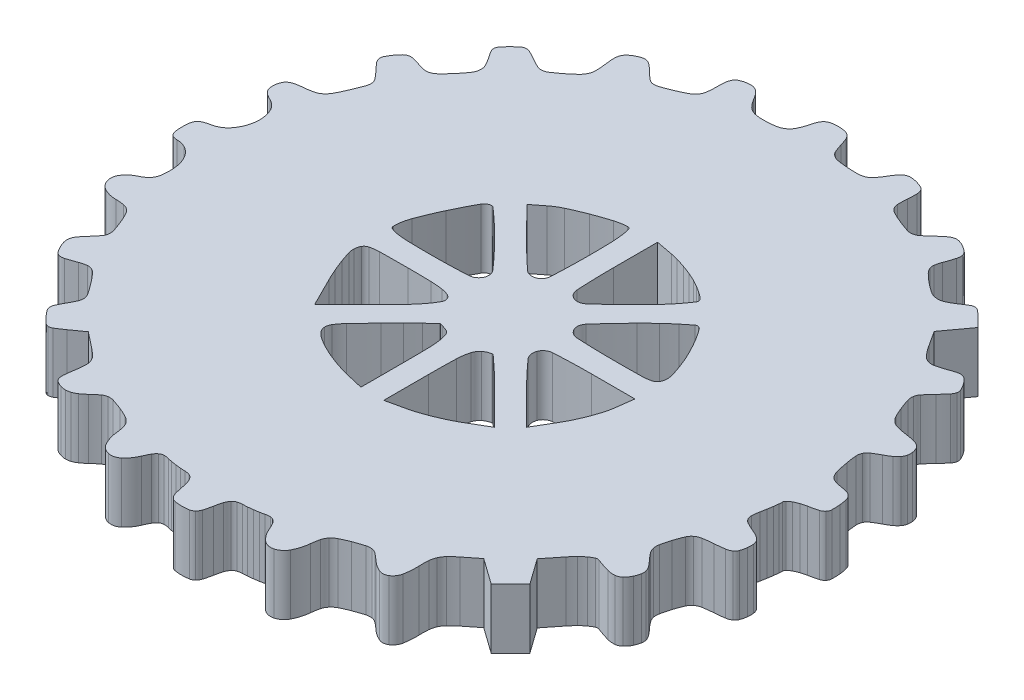
from build123d import *

# Parameters (mm, degrees)
BOSS_EXTRUDE1_DEPTH = 1
SCALE1_SCALE        = 42


with BuildPart() as part:
    # Sketch1 → Boss-Extrude1 (new body)
    with BuildSketch(Plane(origin=(0, 0, 0), x_dir=(1, 0, 0), z_dir=(0, 1, 0))):
        with BuildLine():
            Line((10740.074433407, 3244.208549492), (10740.283419679, 3244.357360853))
            Line((10740.283419679, 3244.357360853), (10740.526958156, 3244.166763317))
            ThreePointArc((10740.526958156, 3244.166763317), (10740.596441055, 3244.109518452), (10740.662967002, 3244.048862486))
            ThreePointArc((10740.662967002, 3244.048862486), (10740.697910655, 3244.007526997), (10740.723503483, 3243.959833301))
            ThreePointArc((10740.723503483, 3243.959833301), (10740.738165734, 3243.908707265), (10740.74146969, 3243.855623019))
            ThreePointArc((10740.74146969, 3243.855623019), (10740.735078414, 3243.769929716), (10740.723894084, 3243.684729356))
            ThreePointArc((10740.723894084, 3243.684729356), (10740.712253348, 3243.602537411), (10740.703557142, 3243.519981984))
            ThreePointArc((10740.703557142, 3243.519981984), (10740.704378804, 3243.476674484), (10740.714298828, 3243.434510425))
            ThreePointArc((10740.714298828, 3243.434510425), (10740.731066326, 3243.404155572), (10740.756883883, 3243.381003471))
            ThreePointArc((10740.756883883, 3243.381003471), (10740.79946354, 3243.357773389), (10740.844661407, 3243.340171777))
            ThreePointArc((10740.844661407, 3243.340171777), (10740.887751217, 3243.329889789), (10740.931879165, 3243.325994234))
            ThreePointArc((10740.931879165, 3243.325994234), (10740.973993155, 3243.328922243), (10741.015017251, 3243.338881406))
            ThreePointArc((10741.015017251, 3243.338881406), (10741.058887667, 3243.357110334), (10741.099722923, 3243.381387671))
            ThreePointArc((10741.099722923, 3243.381387671), (10741.147341166, 3243.41716042), (10741.192213188, 3243.456322751))
            ThreePointArc((10741.192213188, 3243.456322751), (10741.248594743, 3243.506337601), (10741.307739475, 3243.553052327))
            ThreePointArc((10741.307739475, 3243.553052327), (10741.345796905, 3243.574276951), (10741.388057704, 3243.584901336))
            ThreePointArc((10741.388057704, 3243.584901336), (10741.435491272, 3243.585271253), (10741.481915987, 3243.575533384))
            ThreePointArc((10741.481915987, 3243.575533384), (10741.572466774, 3243.544516154), (10741.661980473, 3243.510622033))
            ThreePointArc((10741.661980473, 3243.510622033), (10741.740568657, 3243.476890803), (10741.817184023, 3243.438891011))
            ThreePointArc((10741.817184023, 3243.438891011), (10741.863418008, 3243.408420708), (10741.903082074, 3243.369784164))
            ThreePointArc((10741.903082074, 3243.369784164), (10741.931919686, 3243.327176018), (10741.950884239, 3243.279349166))
            ThreePointArc((10741.950884239, 3243.279349166), (10741.966827587, 3243.210056526), (10741.976814794, 3243.139658259))
            ThreePointArc((10741.976814794, 3243.139658259), (10742.002448782, 3243.010444585), (10742.052640957, 3242.888649591))
            ThreePointArc((10742.052640957, 3242.888649591), (10742.11741492, 3242.811397421), (10742.208001403, 3242.767152044))
            ThreePointArc((10742.208001403, 3242.767152044), (10742.301649043, 3242.766532205), (10742.385137294, 3242.808958336))
            ThreePointArc((10742.385137294, 3242.808958336), (10742.466720923, 3242.897440298), (10742.52548375, 3243.002473037))
            ThreePointArc((10742.52548375, 3243.002473037), (10742.551916827, 3243.061388768), (10742.581725217, 3243.118670798))
            ThreePointArc((10742.581725217, 3243.118670798), (10742.60534874, 3243.15217229), (10742.635454523, 3243.179994272))
            ThreePointArc((10742.635454523, 3243.179994272), (10742.665408797, 3243.196107102), (10742.698749215, 3243.202837508))
            ThreePointArc((10742.698749215, 3243.202837508), (10742.740911169, 3243.201717964), (10742.782378334, 3243.194013548))
            ThreePointArc((10742.782378334, 3243.194013548), (10742.818709321, 3243.185028526), (10742.855368028, 3243.177491254))
            ThreePointArc((10742.855368028, 3243.177491254), (10742.899150416, 3243.169929059), (10742.943100517, 3243.163411932))
            ThreePointArc((10742.943100517, 3243.163411932), (10742.987075383, 3243.15795862), (10743.031167752, 3243.153555158))
            ThreePointArc((10743.031167752, 3243.153555158), (10743.068116243, 3243.151064448), (10743.105135397, 3243.150076094))
            ThreePointArc((10743.105135397, 3243.150076094), (10743.146525145, 3243.146143619), (10743.186579329, 3243.13499741))
            ThreePointArc((10743.186579329, 3243.13499741), (10743.218277129, 3243.117906199), (10743.244280026, 3243.09299216))
            ThreePointArc((10743.244280026, 3243.09299216), (10743.268631813, 3243.05568758), (10743.285607477, 3243.014499378))
            ThreePointArc((10743.285607477, 3243.014499378), (10743.303720248, 3242.948872196), (10743.318138248, 3242.882335583))
            ThreePointArc((10743.318138248, 3242.882335583), (10743.333961344, 3242.808713676), (10743.353627026, 3242.736023811))
            ThreePointArc((10743.353627026, 3242.736023811), (10743.37098035, 3242.696552266), (10743.397473344, 3242.662533711))
            ThreePointArc((10743.397473344, 3242.662533711), (10743.429020625, 3242.639307278), (10743.466042295, 3242.62649736))
            ThreePointArc((10743.466042295, 3242.62649736), (10743.525192509, 3242.618356676), (10743.584838248, 3242.615635583))
            ThreePointArc((10743.584838248, 3242.615635583), (10743.644483986, 3242.618356676), (10743.7036342, 3242.62649736))
            ThreePointArc((10743.7036342, 3242.62649736), (10743.740655871, 3242.639307278), (10743.772203151, 3242.662533711))
            ThreePointArc((10743.772203151, 3242.662533711), (10743.798696145, 3242.696552266), (10743.816049469, 3242.736023811))
            ThreePointArc((10743.816049469, 3242.736023811), (10743.835715152, 3242.808713676), (10743.851538248, 3242.882335583))
            ThreePointArc((10743.851538248, 3242.882335583), (10743.866116249, 3242.949694769), (10743.884400336, 3243.016143774))
            ThreePointArc((10743.884400336, 3243.016143774), (10743.901396912, 3243.057141353), (10743.925963931, 3243.094102775))
            ThreePointArc((10743.925963931, 3243.094102775), (10743.952513167, 3243.118822075), (10743.984782406, 3243.135393192))
            ThreePointArc((10743.984782406, 3243.135393192), (10744.026567429, 3243.146246022), (10744.069568622, 3243.150076094))
            ThreePointArc((10744.069568622, 3243.150076094), (10744.10755751, 3243.151065395), (10744.145477233, 3243.153561177))
            ThreePointArc((10744.145477233, 3243.153561177), (10744.190374429, 3243.157952035), (10744.235154194, 3243.163411932))
            ThreePointArc((10744.235154194, 3243.163411932), (10744.279669278, 3243.169920387), (10744.324016424, 3243.177488968))
            ThreePointArc((10744.324016424, 3243.177488968), (10744.360852789, 3243.185005789), (10744.397353209, 3243.194013548))
            ThreePointArc((10744.397353209, 3243.194013548), (10744.438820374, 3243.201717964), (10744.480982328, 3243.202837508))
            ThreePointArc((10744.480982328, 3243.202837508), (10744.514322746, 3243.196107102), (10744.54427702, 3243.179994272))
            ThreePointArc((10744.54427702, 3243.179994272), (10744.574382802, 3243.15217229), (10744.598006326, 3243.118670798))
            ThreePointArc((10744.598006326, 3243.118670798), (10744.627814716, 3243.061388768), (10744.654247793, 3243.002473037))
            ThreePointArc((10744.654247793, 3243.002473037), (10744.713333089, 3242.896798932), (10744.79533316, 3242.807725496))
            ThreePointArc((10744.79533316, 3242.807725496), (10744.878895795, 3242.765509222), (10744.972505322, 3242.766987147))
            ThreePointArc((10744.972505322, 3242.766987147), (10745.063287397, 3242.812720388), (10745.127676564, 3242.891377551))
            ThreePointArc((10745.127676564, 3242.891377551), (10745.17751834, 3243.015596826), (10745.202916749, 3243.147010492))
            ThreePointArc((10745.202916749, 3243.147010492), (10745.212831011, 3243.2201075), (10745.228442911, 3243.29220281))
            ThreePointArc((10745.228442911, 3243.29220281), (10745.246704719, 3243.340113978), (10745.275125926, 3243.382789599))
            ThreePointArc((10745.275125926, 3243.382789599), (10745.31408887, 3243.420708524), (10745.359794566, 3243.450152456))
            ThreePointArc((10745.359794566, 3243.450152456), (10745.437013645, 3243.486974008), (10745.516145002, 3243.519483102))
            ThreePointArc((10745.516145002, 3243.519483102), (10745.604834591, 3243.551313454), (10745.694592372, 3243.579993675))
            ThreePointArc((10745.694592372, 3243.579993675), (10745.742038199, 3243.588725509), (10745.790247375, 3243.58692917))
            ThreePointArc((10745.790247375, 3243.58692917), (10745.834102364, 3243.574673903), (10745.873533213, 3243.551899802))
            ThreePointArc((10745.873533213, 3243.551899802), (10745.936030865, 3243.501814129), (10745.995819659, 3243.448524062))
            ThreePointArc((10745.995819659, 3243.448524062), (10746.081017568, 3243.381468959), (10746.176578175, 3243.330251375))
            ThreePointArc((10746.176578175, 3243.330251375), (10746.250689502, 3243.318289874), (10746.321729497, 3243.342556837))
            ThreePointArc((10746.321729497, 3243.342556837), (10746.381649137, 3243.401058157), (10746.414109805, 3243.478253187))
            ThreePointArc((10746.414109805, 3243.478253187), (10746.431421076, 3243.604109068), (10746.433108066, 3243.731138737))
            ThreePointArc((10746.433108066, 3243.731138737), (10746.431802994, 3243.811493208), (10746.435669452, 3243.891765213))
            ThreePointArc((10746.435669452, 3243.891765213), (10746.44511738, 3243.94861337), (10746.463978895, 3244.0030672))
            ThreePointArc((10746.463978895, 3244.0030672), (10746.491476128, 3244.052924743), (10746.527117682, 3244.097326905))
            ThreePointArc((10746.527117682, 3244.097326905), (10746.58287424, 3244.151784438), (10746.642264035, 3244.202254914))
            Line((10746.642264035, 3244.202254914), (10746.865677711, 3244.379174246))
            Line((10746.865677711, 3244.379174246), (10747.081750431, 3244.225316921))
            Line((10747.081750431, 3244.225316921), (10747.297823151, 3244.071459596))
            Line((10747.297823151, 3244.071459596), (10747.459132455, 3244.2327689))
            Line((10747.459132455, 3244.2327689), (10747.620441759, 3244.394078204))
            Line((10747.620441759, 3244.394078204), (10747.467779936, 3244.608471933))
            Line((10747.467779936, 3244.608471933), (10747.315118113, 3244.822865738))
            Line((10747.315118113, 3244.822865738), (10747.528941942, 3245.091430581))
            ThreePointArc((10747.528941942, 3245.091430581), (10747.572647945, 3245.143303748), (10747.619164418, 3245.192672339))
            ThreePointArc((10747.619164418, 3245.192672339), (10747.663231099, 3245.233522951), (10747.71040927, 3245.270736725))
            ThreePointArc((10747.71040927, 3245.270736725), (10747.749729632, 3245.296626084), (10747.791251527, 3245.318813514))
            ThreePointArc((10747.791251527, 3245.318813514), (10747.817949927, 3245.325423554), (10747.845094827, 3245.320990548))
            ThreePointArc((10747.845094827, 3245.320990548), (10747.956592049, 3245.281096056), (10748.069634815, 3245.245818105))
            ThreePointArc((10748.069634815, 3245.245818105), (10748.136772514, 3245.233139997), (10748.205096241, 3245.233410917))
            ThreePointArc((10748.205096241, 3245.233410917), (10748.254433512, 3245.246626323), (10748.296971114, 3245.274899378))
            ThreePointArc((10748.296971114, 3245.274899378), (10748.337353886, 3245.320521803), (10748.368164241, 3245.373085059))
            ThreePointArc((10748.368164241, 3245.373085059), (10748.387797837, 3245.422241635), (10748.402120866, 3245.473199439))
            ThreePointArc((10748.402120866, 3245.473199439), (10748.406123854, 3245.512902509), (10748.400532706, 3245.552413225))
            ThreePointArc((10748.400532706, 3245.552413225), (10748.384777717, 3245.594593068), (10748.361235299, 3245.632974227))
            ThreePointArc((10748.361235299, 3245.632974227), (10748.316845967, 3245.688679151), (10748.269593674, 3245.741977108))
            ThreePointArc((10748.269593674, 3245.741977108), (10748.218715914, 3245.799745927), (10748.171338574, 3245.860418578))
            ThreePointArc((10748.171338574, 3245.860418578), (10748.147054637, 3245.902416081), (10748.132444037, 3245.948676542))
            ThreePointArc((10748.132444037, 3245.948676542), (10748.127602294, 3245.998880229), (10748.132891712, 3246.049038724))
            ThreePointArc((10748.132891712, 3246.049038724), (10748.152253002, 3246.132215804), (10748.175423199, 3246.214413298))
            ThreePointArc((10748.175423199, 3246.214413298), (10748.202989565, 3246.295914221), (10748.235133672, 3246.375720621))
            ThreePointArc((10748.235133672, 3246.375720621), (10748.260891475, 3246.418823525), (10748.296680107, 3246.454044239))
            ThreePointArc((10748.296680107, 3246.454044239), (10748.341152037, 3246.480089921), (10748.390546696, 3246.494796989))
            ThreePointArc((10748.390546696, 3246.494796989), (10748.481770871, 3246.508132379), (10748.573530175, 3246.517071773))
            ThreePointArc((10748.573530175, 3246.517071773), (10748.661269881, 3246.525200856), (10748.748630765, 3246.53670798))
            ThreePointArc((10748.748630765, 3246.53670798), (10748.79408457, 3246.548733822), (10748.835887918, 3246.570254725))
            ThreePointArc((10748.835887918, 3246.570254725), (10748.864524442, 3246.596606073), (10748.883414773, 3246.630629585))
            ThreePointArc((10748.883414773, 3246.630629585), (10748.899243437, 3246.683869725), (10748.908824882, 3246.738580373))
            ThreePointArc((10748.908824882, 3246.738580373), (10748.911904869, 3246.791265861), (10748.908953736, 3246.843958724))
            ThreePointArc((10748.908953736, 3246.843958724), (10748.89939208, 3246.882692414), (10748.880271218, 3246.917708361))
            ThreePointArc((10748.880271218, 3246.917708361), (10748.850494987, 3246.950668734), (10748.814451334, 3246.976627649))
            ThreePointArc((10748.814451334, 3246.976627649), (10748.754258299, 3247.008487913), (10748.692185996, 3247.036511247))
            ThreePointArc((10748.692185996, 3247.036511247), (10748.625184118, 3247.066438897), (10748.559920703, 3247.099988895))
            ThreePointArc((10748.559920703, 3247.099988895), (10748.526444894, 3247.124634018), (10748.500585592, 3247.157181034))
            ThreePointArc((10748.500585592, 3247.157181034), (10748.485490133, 3247.193731469), (10748.481660103, 3247.23309056))
            ThreePointArc((10748.481660103, 3247.23309056), (10748.487302385, 3247.297710591), (10748.497676962, 3247.361741458))
            ThreePointArc((10748.497676962, 3247.361741458), (10748.50668515, 3247.408642953), (10748.514975581, 3247.455676627))
            ThreePointArc((10748.514975581, 3247.455676627), (10748.522636851, 3247.503323132), (10748.529591579, 3247.551077884))
            ThreePointArc((10748.529591579, 3247.551077884), (10748.535090352, 3247.593180436), (10748.539970248, 3247.635359199))
            ThreePointArc((10748.539970248, 3247.635359199), (10748.542141379, 3247.662144424), (10748.542865771, 3247.689007733))
            ThreePointArc((10748.542865771, 3247.689007733), (10748.547752305, 3247.7122233), (10748.561582701, 3247.731499215))
            ThreePointArc((10748.561582701, 3247.731499215), (10748.590724503, 3247.755242581), (10748.622389996, 3247.775498162))
            ThreePointArc((10748.622389996, 3247.775498162), (10748.665252675, 3247.796961527), (10748.709959494, 3247.814258511))
            ThreePointArc((10748.709959494, 3247.814258511), (10748.76137366, 3247.829465445), (10748.813703279, 3247.84113928))
            ThreePointArc((10748.813703279, 3247.84113928), (10748.89298929, 3247.857852496), (10748.971450919, 3247.878085536))
            ThreePointArc((10748.971450919, 3247.878085536), (10749.00831331, 3247.894621253), (10749.038802727, 3247.921129011))
            ThreePointArc((10749.038802727, 3247.921129011), (10749.058334303, 3247.953788679), (10749.065917507, 3247.991079849))
            ThreePointArc((10749.065917507, 3247.991079849), (10749.065871249, 3248.060784268), (10749.061353279, 3248.130342131))
            ThreePointArc((10749.061353279, 3248.130342131), (10749.053217814, 3248.191386868), (10749.040768687, 3248.251699927))
            ThreePointArc((10749.040768687, 3248.251699927), (10749.026578389, 3248.290638163), (10749.004205184, 3248.325523554))
            ThreePointArc((10749.004205184, 3248.325523554), (10748.976817154, 3248.351545318), (10748.943648358, 3248.369630324))
            ThreePointArc((10748.943648358, 3248.369630324), (10748.89638316, 3248.384766267), (10748.847665771, 3248.394237894))
            ThreePointArc((10748.847665771, 3248.394237894), (10748.769714515, 3248.407976182), (10748.693165395, 3248.428110014))
            ThreePointArc((10748.693165395, 3248.428110014), (10748.647414728, 3248.449905661), (10748.609876737, 3248.483950821))
            ThreePointArc((10748.609876737, 3248.483950821), (10748.578312819, 3248.532298465), (10748.558033229, 3248.586358745))
            ThreePointArc((10748.558033229, 3248.586358745), (10748.532623967, 3248.694487102), (10748.511195299, 3248.803474185))
            ThreePointArc((10748.511195299, 3248.803474185), (10748.498345791, 3248.887244874), (10748.489464049, 3248.971528637))
            ThreePointArc((10748.489464049, 3248.971528637), (10748.491604131, 3249.017310383), (10748.505275549, 3249.06105556))
            ThreePointArc((10748.505275549, 3249.06105556), (10748.529209616, 3249.098553054), (10748.562402461, 3249.128169548))
            ThreePointArc((10748.562402461, 3249.128169548), (10748.628650714, 3249.169970629), (10748.697176182, 3249.207923516))
            ThreePointArc((10748.697176182, 3249.207923516), (10748.753403166, 3249.239397138), (10748.80742798, 3249.274516677))
            ThreePointArc((10748.80742798, 3249.274516677), (10748.843749411, 3249.304582342), (10748.874677071, 3249.340172655))
            ThreePointArc((10748.874677071, 3249.340172655), (10748.894617843, 3249.374484129), (10748.90681785, 3249.412247492))
            ThreePointArc((10748.90681785, 3249.412247492), (10748.91186594, 3249.454547925), (10748.909539028, 3249.497084914))
            ThreePointArc((10748.909539028, 3249.497084914), (10748.89952172, 3249.540111354), (10748.882175913, 3249.580740703))
            ThreePointArc((10748.882175913, 3249.580740703), (10748.859631192, 3249.612467782), (10748.829842058, 3249.637517323))
            ThreePointArc((10748.829842058, 3249.637517323), (10748.786648254, 3249.66033847), (10748.740179499, 3249.67541044))
            ThreePointArc((10748.740179499, 3249.67541044), (10748.665957765, 3249.690665894), (10748.591072939, 3249.702235583))
            ThreePointArc((10748.591072939, 3249.702235583), (10748.508101856, 3249.715678489), (10748.426162271, 3249.734408595))
            ThreePointArc((10748.426162271, 3249.734408595), (10748.374213359, 3249.754045209), (10748.327476565, 3249.784044513))
            ThreePointArc((10748.327476565, 3249.784044513), (10748.287087112, 3249.823687956), (10748.255454688, 3249.870616628))
            ThreePointArc((10748.255454688, 3249.870616628), (10748.215983142, 3249.949539638), (10748.181078077, 3250.030585803))
            ThreePointArc((10748.181078077, 3250.030585803), (10748.146533052, 3250.122124445), (10748.115171097, 3250.214801894))
            ThreePointArc((10748.115171097, 3250.214801894), (10748.10612457, 3250.261867599), (10748.108441799, 3250.309738788))
            ThreePointArc((10748.108441799, 3250.309738788), (10748.122006532, 3250.354305776), (10748.14641104, 3250.393987489))
            ThreePointArc((10748.14641104, 3250.393987489), (10748.204465771, 3250.462842253), (10748.265381566, 3250.529179243))
            ThreePointArc((10748.265381566, 3250.529179243), (10748.324016715, 3250.592422824), (10748.380549103, 3250.65755285))
            ThreePointArc((10748.380549103, 3250.65755285), (10748.403119981, 3250.692079772), (10748.416876768, 3250.730968121))
            ThreePointArc((10748.416876768, 3250.730968121), (10748.418778603, 3250.766591362), (10748.408884302, 3250.800865771))
            ThreePointArc((10748.408884302, 3250.800865771), (10748.381098045, 3250.853095053), (10748.34915737, 3250.902892313))
            ThreePointArc((10748.34915737, 3250.902892313), (10748.316395087, 3250.945846466), (10748.280258016, 3250.986002891))
            ThreePointArc((10748.280258016, 3250.986002891), (10748.251870059, 3251.008512536), (10748.218735813, 3251.023164564))
            ThreePointArc((10748.218735813, 3251.023164564), (10748.182651136, 3251.029158487), (10748.146203547, 3251.026059402))
            ThreePointArc((10748.146203547, 3251.026059402), (10748.092619656, 3251.012492101), (10748.040236246, 3250.994848873))
            ThreePointArc((10748.040236246, 3250.994848873), (10747.944308865, 3250.961929759), (10747.846432671, 3250.935359457))
            ThreePointArc((10747.846432671, 3250.935359457), (10747.78617895, 3250.929705802), (10747.726682085, 3250.940778191))
            ThreePointArc((10747.726682085, 3250.940778191), (10747.672090772, 3250.967801144), (10747.626837454, 3251.008575998))
            ThreePointArc((10747.626837454, 3251.008575998), (10747.562915961, 3251.089420973), (10747.504213442, 3251.174131547))
            Line((10747.504213442, 3251.174131547), (10747.341861112, 3251.424941028))
            Line((10747.341861112, 3251.424941028), (10747.495976984, 3251.636508118))
            Line((10747.495976984, 3251.636508118), (10747.650092855, 3251.848075208))
            Line((10747.650092855, 3251.848075208), (10747.494296545, 3252.003871442))
            ThreePointArc((10747.494296545, 3252.003871442), (10747.446489374, 3252.049480357), (10747.396589857, 3252.092790137))
            ThreePointArc((10747.396589857, 3252.092790137), (10747.367895297, 3252.110085582), (10747.335389675, 3252.118203141))
            ThreePointArc((10747.335389675, 3252.118203141), (10747.302217093, 3252.116342491), (10747.271120156, 3252.104643656))
            ThreePointArc((10747.271120156, 3252.104643656), (10747.215570152, 3252.071605601), (10747.161728046, 3252.035851668))
            ThreePointArc((10747.161728046, 3252.035851668), (10747.083033974, 3251.985721768), (10747.000254683, 3251.942671184))
            ThreePointArc((10747.000254683, 3251.942671184), (10746.940704506, 3251.924440591), (10746.878438392, 3251.923212142))
            ThreePointArc((10746.878438392, 3251.923212142), (10746.812795784, 3251.939049006), (10746.752662367, 3251.969769199))
            ThreePointArc((10746.752662367, 3251.969769199), (10746.659907262, 3252.035630465), (10746.570892296, 3252.106465141))
            ThreePointArc((10746.570892296, 3252.106465141), (10746.507877358, 3252.161851036), (10746.447306945, 3252.219900195))
            ThreePointArc((10746.447306945, 3252.219900195), (10746.416535629, 3252.257480898), (10746.393758005, 3252.300380349))
            ThreePointArc((10746.393758005, 3252.300380349), (10746.383274269, 3252.340622477), (10746.38384187, 3252.382203909))
            ThreePointArc((10746.38384187, 3252.382203909), (10746.395272958, 3252.438091201), (10746.412645775, 3252.492425761))
            ThreePointArc((10746.412645775, 3252.492425761), (10746.444002399, 3252.580226095), (10746.471768897, 3252.669226982))
            ThreePointArc((10746.471768897, 3252.669226982), (10746.479445542, 3252.716902441), (10746.475333076, 3252.765016554))
            ThreePointArc((10746.475333076, 3252.765016554), (10746.460028842, 3252.803670556), (10746.432756022, 3252.835048012))
            ThreePointArc((10746.432756022, 3252.835048012), (10746.380781401, 3252.873531791), (10746.325313945, 3252.906784216))
            ThreePointArc((10746.325313945, 3252.906784216), (10746.280234526, 3252.927462417), (10746.232963889, 3252.942470048))
            ThreePointArc((10746.232963889, 3252.942470048), (10746.195100417, 3252.946808749), (10746.157416618, 3252.941116812))
            ThreePointArc((10746.157416618, 3252.941116812), (10746.115398314, 3252.924446259), (10746.077322798, 3252.900080292))
            ThreePointArc((10746.077322798, 3252.900080292), (10746.019218895, 3252.852323119), (10745.963363945, 3252.801954123))
            ThreePointArc((10745.963363945, 3252.801954123), (10745.899221141, 3252.744070713), (10745.832532127, 3252.689140176))
            ThreePointArc((10745.832532127, 3252.689140176), (10745.793334045, 3252.665825859), (10745.749462849, 3252.653361304))
            ThreePointArc((10745.749462849, 3252.653361304), (10745.701830836, 3252.651903556), (10745.655146528, 3252.661469594))
            ThreePointArc((10745.655146528, 3252.661469594), (10745.562440316, 3252.69374041), (10745.470850275, 3252.729054879))
            ThreePointArc((10745.470850275, 3252.729054879), (10745.38532485, 3252.765810387), (10745.301448607, 3252.806187872))
            ThreePointArc((10745.301448607, 3252.806187872), (10745.260898543, 3252.83359438), (10745.228339583, 3252.870136664))
            ThreePointArc((10745.228339583, 3252.870136664), (10745.207735547, 3252.911525115), (10745.199517315, 3252.957022266))
            ThreePointArc((10745.199517315, 3252.957022266), (10745.199009393, 3253.037085039), (10745.203425155, 3253.11702756))
            ThreePointArc((10745.203425155, 3253.11702756), (10745.208141858, 3253.192825281), (10745.20924714, 3253.268761572))
            ThreePointArc((10745.20924714, 3253.268761572), (10745.203755976, 3253.31050475), (10745.188377865, 3253.349698621))
            ThreePointArc((10745.188377865, 3253.349698621), (10745.165726499, 3253.379406239), (10745.135050362, 3253.400727627))
            ThreePointArc((10745.135050362, 3253.400727627), (10745.082824836, 3253.423048208), (10745.028716767, 3253.440311775))
            ThreePointArc((10745.028716767, 3253.440311775), (10744.974546866, 3253.451913605), (10744.91948521, 3253.458012349))
            ThreePointArc((10744.91948521, 3253.458012349), (10744.880171441, 3253.455092853), (10744.843036798, 3253.441859778))
            ThreePointArc((10744.843036798, 3253.441859778), (10744.806880774, 3253.417771855), (10744.776932841, 3253.386297938))
            ThreePointArc((10744.776932841, 3253.386297938), (10744.736229633, 3253.329326405), (10744.698889182, 3253.270096367))
            ThreePointArc((10744.698889182, 3253.270096367), (10744.65880769, 3253.207615336), (10744.614238907, 3253.148251805))
            ThreePointArc((10744.614238907, 3253.148251805), (10744.57880702, 3253.113701858), (10744.536319987, 3253.088325306))
            ThreePointArc((10744.536319987, 3253.088325306), (10744.485683923, 3253.071506717), (10744.432708942, 3253.065140618))
            ThreePointArc((10744.432708942, 3253.065140618), (10744.342476711, 3253.065504112), (10744.252357411, 3253.070031743))
            ThreePointArc((10744.252357411, 3253.070031743), (10744.161699734, 3253.078746335), (10744.071527114, 3253.091539193))
            ThreePointArc((10744.071527114, 3253.091539193), (10744.0224175, 3253.105434579), (10743.977634084, 3253.129914809))
            ThreePointArc((10743.977634084, 3253.129914809), (10743.943025589, 3253.161875292), (10743.91804576, 3253.201815605))
            ThreePointArc((10743.91804576, 3253.201815605), (10743.889969127, 3253.270356448), (10743.867037023, 3253.340785583))
            ThreePointArc((10743.867037023, 3253.340785583), (10743.846043623, 3253.406285926), (10743.820854794, 3253.47029015))
            ThreePointArc((10743.820854794, 3253.47029015), (10743.798822327, 3253.508762211), (10743.7687439, 3253.541332401))
            ThreePointArc((10743.7687439, 3253.541332401), (10743.734323309, 3253.564035465), (10743.695241532, 3253.577181605))
            ThreePointArc((10743.695241532, 3253.577181605), (10743.638042787, 3253.585615372), (10743.580294442, 3253.588435583))
            ThreePointArc((10743.580294442, 3253.588435583), (10743.524337883, 3253.585942299), (10743.468824814, 3253.578482263))
            ThreePointArc((10743.468824814, 3253.578482263), (10743.4310713, 3253.566813928), (10743.397240325, 3253.546394748))
            ThreePointArc((10743.397240325, 3253.546394748), (10743.369350418, 3253.518443874), (10743.349026299, 3253.484590833))
            ThreePointArc((10743.349026299, 3253.484590833), (10743.328590745, 3253.432546764), (10743.312884867, 3253.378885583))
            ThreePointArc((10743.312884867, 3253.378885583), (10743.288024621, 3253.295837628), (10743.254863139, 3253.215741993))
            ThreePointArc((10743.254863139, 3253.215741993), (10743.220860474, 3253.163009854), (10743.174499343, 3253.120730956))
            ThreePointArc((10743.174499343, 3253.120730956), (10743.115730043, 3253.089026852), (10743.05126977, 3253.071595443))
            ThreePointArc((10743.05126977, 3253.071595443), (10742.951523989, 3253.060296511), (10742.851223815, 3253.056202434))
            ThreePointArc((10742.851223815, 3253.056202434), (10742.788383639, 3253.058719815), (10742.726021347, 3253.066854279))
            ThreePointArc((10742.726021347, 3253.066854279), (10742.677676092, 3253.079831123), (10742.632337029, 3253.101045067))
            ThreePointArc((10742.632337029, 3253.101045067), (10742.590868058, 3253.130115284), (10742.554991438, 3253.165859111))
            ThreePointArc((10742.554991438, 3253.165859111), (10742.515344875, 3253.217019376), (10742.480120137, 3253.27131892))
            ThreePointArc((10742.480120137, 3253.27131892), (10742.446209906, 3253.324415777), (10742.408690333, 3253.375026663))
            ThreePointArc((10742.408690333, 3253.375026663), (10742.377492054, 3253.407561143), (10742.340882773, 3253.433859159))
            ThreePointArc((10742.340882773, 3253.433859159), (10742.304390759, 3253.450126835), (10742.265198875, 3253.457892182))
            ThreePointArc((10742.265198875, 3253.457892182), (10742.217936322, 3253.458628562), (10742.171012094, 3253.452935753))
            ThreePointArc((10742.171012094, 3253.452935753), (10742.123120804, 3253.440567849), (10742.077194349, 3253.422202083))
            ThreePointArc((10742.077194349, 3253.422202083), (10742.046638203, 3253.401581553), (10742.023504972, 3253.372880718))
            ThreePointArc((10742.023504972, 3253.372880718), (10742.005569012, 3253.332910794), (10741.99654907, 3253.29003966))
            ThreePointArc((10741.99654907, 3253.29003966), (10741.990910693, 3253.215814255), (10741.988890741, 3253.141402416))
            ThreePointArc((10741.988890741, 3253.141402416), (10741.985989828, 3253.06132333), (10741.977748396, 3252.981616655))
            ThreePointArc((10741.977748396, 3252.981616655), (10741.964766076, 3252.93311433), (10741.940179586, 3252.889336245))
            ThreePointArc((10741.940179586, 3252.889336245), (10741.904037441, 3252.850351761), (10741.860212411, 3252.820261707))
            ThreePointArc((10741.860212411, 3252.820261707), (10741.777170377, 3252.778335702), (10741.692260981, 3252.740333546))
            ThreePointArc((10741.692260981, 3252.740333546), (10741.597776074, 3252.702267602), (10741.502228621, 3252.666953327))
            ThreePointArc((10741.502228621, 3252.666953327), (10741.456917654, 3252.656754901), (10741.410478334, 3252.65744852))
            ThreePointArc((10741.410478334, 3252.65744852), (10741.368572948, 3252.669180474), (10741.331536277, 3252.69202747))
            ThreePointArc((10741.331536277, 3252.69202747), (10741.268089788, 3252.747205863), (10741.20727046, 3252.805267223))
            ThreePointArc((10741.20727046, 3252.805267223), (10741.154468374, 3252.855621434), (10741.099337351, 3252.9034145))
            ThreePointArc((10741.099337351, 3252.9034145), (10741.063253511, 3252.927503475), (10741.023042254, 3252.94379387))
            ThreePointArc((10741.023042254, 3252.94379387), (10740.986186068, 3252.949233504), (10740.949228304, 3252.944533315))
            ThreePointArc((10740.949228304, 3252.944533315), (10740.901438765, 3252.928690565), (10740.855765651, 3252.907505678))
            ThreePointArc((10740.855765651, 3252.907505678), (10740.813273752, 3252.881136793), (10740.774495761, 3252.849559159))
            ThreePointArc((10740.774495761, 3252.849559159), (10740.748950131, 3252.819111195), (10740.731753809, 3252.783279027))
            ThreePointArc((10740.731753809, 3252.783279027), (10740.720930174, 3252.737236996), (10740.71864238, 3252.689995216))
            ThreePointArc((10740.71864238, 3252.689995216), (10740.723712139, 3252.613722306), (10740.732361428, 3252.537772))
            ThreePointArc((10740.732361428, 3252.537772), (10740.740979008, 3252.456718882), (10740.7445612, 3252.375287692))
            ThreePointArc((10740.7445612, 3252.375287692), (10740.739706781, 3252.322276294), (10740.723979428, 3252.271419396))
            ThreePointArc((10740.723979428, 3252.271419396), (10740.697688464, 3252.223739081), (10740.662473836, 3252.182211294))
            ThreePointArc((10740.662473836, 3252.182211294), (10740.598685356, 3252.123866313), (10740.531849586, 3252.06903852))
            ThreePointArc((10740.531849586, 3252.06903852), (10740.45539065, 3252.011611748), (10740.377143774, 3251.956646035))
            ThreePointArc((10740.377143774, 3251.956646035), (10740.337195606, 3251.936076188), (10740.293482804, 3251.925675917))
            ThreePointArc((10740.293482804, 3251.925675917), (10740.250595934, 3251.92668876), (10740.209563591, 3251.939204998))
            ThreePointArc((10740.209563591, 3251.939204998), (10740.134536488, 3251.975862561), (10740.061208897, 3252.015811373))
            ThreePointArc((10740.061208897, 3252.015811373), (10739.988788723, 3252.055890086), (10739.915156585, 3252.093696078))
            ThreePointArc((10739.915156585, 3252.093696078), (10739.879311854, 3252.106110759), (10739.841507685, 3252.109243469))
            ThreePointArc((10739.841507685, 3252.109243469), (10739.807527029, 3252.102365663), (10739.777332655, 3252.085327794))
            ThreePointArc((10739.777332655, 3252.085327794), (10739.728006683, 3252.043830702), (10739.681139223, 3251.999575743))
            ThreePointArc((10739.681139223, 3251.999575743), (10739.637825796, 3251.954012768), (10739.596872843, 3251.906316926))
            ThreePointArc((10739.596872843, 3251.906316926), (10739.580335311, 3251.878243648), (10739.572948253, 3251.846509908))
            ThreePointArc((10739.572948253, 3251.846509908), (10739.575294015, 3251.813684838), (10739.58712671, 3251.782976939))
            ThreePointArc((10739.58712671, 3251.782976939), (10739.62029283, 3251.727618903), (10739.656049687, 3251.673897858))
            ThreePointArc((10739.656049687, 3251.673897858), (10739.705037356, 3251.597878114), (10739.748019429, 3251.518308431))
            ThreePointArc((10739.748019429, 3251.518308431), (10739.765215452, 3251.464682704), (10739.766203035, 3251.408375986))
            ThreePointArc((10739.766203035, 3251.408375986), (10739.750983085, 3251.349452173), (10739.721772949, 3251.296062749))
            ThreePointArc((10739.721772949, 3251.296062749), (10739.655384859, 3251.208508764), (10739.584836824, 3251.124270687))
            ThreePointArc((10739.584836824, 3251.124270687), (10739.52874744, 3251.063410875), (10739.469891258, 3251.005222512))
            ThreePointArc((10739.469891258, 3251.005222512), (10739.432008461, 3250.976580111), (10739.388824593, 3250.956815319))
            ThreePointArc((10739.388824593, 3250.956815319), (10739.345522575, 3250.94835773), (10739.301486134, 3250.951075707))
            ThreePointArc((10739.301486134, 3250.951075707), (10739.234786627, 3250.966379332), (10739.169386195, 3250.986524023))
            ThreePointArc((10739.169386195, 3250.986524023), (10739.106283557, 3251.006579128), (10739.042167018, 3251.023108481))
            ThreePointArc((10739.042167018, 3251.023108481), (10739.002863545, 3251.027331196), (10738.963657853, 3251.022280644))
            ThreePointArc((10738.963657853, 3251.022280644), (10738.929544814, 3251.008582857), (10738.900372458, 3250.986215413))
            ThreePointArc((10738.900372458, 3250.986215413), (10738.863108724, 3250.945252697), (10738.829446489, 3250.901282436))
            ThreePointArc((10738.829446489, 3250.901282436), (10738.797929254, 3250.852243856), (10738.770409624, 3250.800855255))
            ThreePointArc((10738.770409624, 3250.800855255), (10738.760458415, 3250.767210384), (10738.761897627, 3250.73215425))
            ThreePointArc((10738.761897627, 3250.73215425), (10738.774743808, 3250.694314136), (10738.796347418, 3250.660695947))
            ThreePointArc((10738.796347418, 3250.660695947), (10738.849539359, 3250.598914819), (10738.904886622, 3250.539056897))
            ThreePointArc((10738.904886622, 3250.539056897), (10738.964315528, 3250.474233657), (10739.020839324, 3250.406862241))
            ThreePointArc((10739.020839324, 3250.406862241), (10739.04337617, 3250.368779444), (10739.054362066, 3250.325913152))
            ThreePointArc((10739.054362066, 3250.325913152), (10739.054069829, 3250.278146024), (10739.042870954, 3250.231709302))
            ThreePointArc((10739.042870954, 3250.231709302), (10739.003309021, 3250.127945783), (10738.961197203, 3250.02519069))
            ThreePointArc((10738.961197203, 3250.02519069), (10738.921440973, 3249.937176594), (10738.87768406, 3249.851081463))
            ThreePointArc((10738.87768406, 3249.851081463), (10738.84526106, 3249.802370273), (10738.804298279, 3249.760584133))
            ThreePointArc((10738.804298279, 3249.760584133), (10738.759980641, 3249.731030825), (10738.710162704, 3249.712172825))
            ThreePointArc((10738.710162704, 3249.712172825), (10738.635929305, 3249.696513411), (10738.560665771, 3249.686962741))
            ThreePointArc((10738.560665771, 3249.686962741), (10738.492724063, 3249.679202954), (10738.42533099, 3249.667607103))
            ThreePointArc((10738.42533099, 3249.667607103), (10738.382878595, 3249.654670486), (10738.34371919, 3249.633787409))
            ThreePointArc((10738.34371919, 3249.633787409), (10738.315941532, 3249.60939409), (10738.295592413, 3249.578530751))
            ThreePointArc((10738.295592413, 3249.578530751), (10738.279367806, 3249.536975526), (10738.269712607, 3249.493422666))
            ThreePointArc((10738.269712607, 3249.493422666), (10738.266848464, 3249.45154351), (10738.270094216, 3249.409692201))
            ThreePointArc((10738.270094216, 3249.409692201), (10738.279478803, 3249.374197129), (10738.296268078, 3249.341546084))
            ThreePointArc((10738.296268078, 3249.341546084), (10738.321372388, 3249.310361631), (10738.351894535, 3249.284456129))
            ThreePointArc((10738.351894535, 3249.284456129), (10738.395371865, 3249.256970739), (10738.441162607, 3249.233541423))
            ThreePointArc((10738.441162607, 3249.233541423), (10738.542696632, 3249.161400111), (10738.610182741, 3249.056714141))
            ThreePointArc((10738.610182741, 3249.056714141), (10738.645840989, 3248.918855343), (10738.645066415, 3248.776461666))
            ThreePointArc((10738.645066415, 3248.776461666), (10738.607790987, 3248.637361316), (10738.536731428, 3248.512105959))
            ThreePointArc((10738.536731428, 3248.512105959), (10738.443327744, 3248.425945309), (10738.32531628, 3248.3788157))
            ThreePointArc((10738.32531628, 3248.3788157), (10738.26603952, 3248.364526433), (10738.208062158, 3248.345644088))
            ThreePointArc((10738.208062158, 3248.345644088), (10738.173203292, 3248.327120687), (10738.144517454, 3248.300002802))
            ThreePointArc((10738.144517454, 3248.300002802), (10738.123830401, 3248.26601168), (10738.112755161, 3248.22779271))
            ThreePointArc((10738.112755161, 3248.22779271), (10738.105791397, 3248.166040586), (10738.103465771, 3248.103940583))
            ThreePointArc((10738.103465771, 3248.103940583), (10738.105203347, 3248.04682981), (10738.110409572, 3247.989930296))
            ThreePointArc((10738.110409572, 3247.989930296), (10738.118753665, 3247.954790729), (10738.134660985, 3247.922365889))
            ThreePointArc((10738.134660985, 3247.922365889), (10738.154188128, 3247.900542071), (10738.179657085, 3247.886087984))
            ThreePointArc((10738.179657085, 3247.886087984), (10738.214478893, 3247.876623568), (10738.250422881, 3247.873435583))
            ThreePointArc((10738.250422881, 3247.873435583), (10738.329026216, 3247.863965048), (10738.403130577, 3247.836095373))
            ThreePointArc((10738.403130577, 3247.836095373), (10738.471172854, 3247.790685182), (10738.527799111, 3247.731648719))
            ThreePointArc((10738.527799111, 3247.731648719), (10738.576095769, 3247.654799799), (10738.609075708, 3247.570238298))
            ThreePointArc((10738.609075708, 3247.570238298), (10738.629884747, 3247.47161337), (10738.636865771, 3247.371059118))
            ThreePointArc((10738.636865771, 3247.371059118), (10738.63456869, 3247.303207267), (10738.627688015, 3247.23566612))
            ThreePointArc((10738.627688015, 3247.23566612), (10738.616864924, 3247.188643853), (10738.597721831, 3247.144351926))
            ThreePointArc((10738.597721831, 3247.144351926), (10738.572608011, 3247.107969079), (10738.540440767, 3247.077642788))
            ThreePointArc((10738.540440767, 3247.077642788), (10738.494974049, 3247.046880729), (10738.446365771, 3247.021370688))
            ThreePointArc((10738.446365771, 3247.021370688), (10738.355401678, 3246.963473389), (10738.283865614, 3246.882794054))
            ThreePointArc((10738.283865614, 3246.882794054), (10738.250691426, 3246.796817491), (10738.256904987, 3246.704872464))
            ThreePointArc((10738.256904987, 3246.704872464), (10738.302143208, 3246.618893693), (10738.377170304, 3246.557170271))
            ThreePointArc((10738.377170304, 3246.557170271), (10738.484567229, 3246.515878409), (10738.598768438, 3246.501835583))
            ThreePointArc((10738.598768438, 3246.501835583), (10738.669131216, 3246.498948938), (10738.739021092, 3246.490308428))
            ThreePointArc((10738.739021092, 3246.490308428), (10738.784788, 3246.476715373), (10738.825783859, 3246.452246604))
            ThreePointArc((10738.825783859, 3246.452246604), (10738.863035741, 3246.416224193), (10738.891890026, 3246.373180646))
            ThreePointArc((10738.891890026, 3246.373180646), (10738.930325181, 3246.295546213), (10738.96482699, 3246.216085583))
            ThreePointArc((10738.96482699, 3246.216085583), (10738.999012067, 3246.127394494), (10739.030213753, 3246.0376104))
            ThreePointArc((10739.030213753, 3246.0376104), (10739.039966733, 3245.991220158), (10739.03931089, 3245.943820316))
            ThreePointArc((10739.03931089, 3245.943820316), (10739.028169681, 3245.900761809), (10739.006424037, 3245.861963762))
            ThreePointArc((10739.006424037, 3245.861963762), (10738.957444283, 3245.799586119), (10738.905292006, 3245.739835583))
            ThreePointArc((10738.905292006, 3245.739835583), (10738.86006607, 3245.68786237), (10738.817763657, 3245.633483091))
            ThreePointArc((10738.817763657, 3245.633483091), (10738.794732468, 3245.595058023), (10738.779261778, 3245.553015434))
            ThreePointArc((10738.779261778, 3245.553015434), (10738.773662852, 3245.513822359), (10738.777305953, 3245.47439936))
            ThreePointArc((10738.777305953, 3245.47439936), (10738.790658087, 3245.425241411), (10738.80942532, 3245.377885583))
            ThreePointArc((10738.80942532, 3245.377885583), (10738.839948596, 3245.318262241), (10738.875114749, 3245.261253863))
            ThreePointArc((10738.875114749, 3245.261253863), (10738.902113838, 3245.233739048), (10738.93718544, 3245.217739091))
            ThreePointArc((10738.93718544, 3245.217739091), (10738.98096014, 3245.212888072), (10739.024453871, 3245.219820037))
            ThreePointArc((10739.024453871, 3245.219820037), (10739.113518932, 3245.24835232), (10739.201514172, 3245.28003061))
            ThreePointArc((10739.201514172, 3245.28003061), (10739.257548265, 3245.297743418), (10739.315236957, 3245.308949577))
            ThreePointArc((10739.315236957, 3245.308949577), (10739.357379726, 3245.308358809), (10739.397498667, 3245.295442441))
            ThreePointArc((10739.397498667, 3245.295442441), (10739.441309982, 3245.26809255), (10739.478965306, 3245.232743938))
            ThreePointArc((10739.478965306, 3245.232743938), (10739.542274895, 3245.157920551), (10739.603023097, 3245.081003068))
            ThreePointArc((10739.603023097, 3245.081003068), (10739.666489504, 3244.995403137), (10739.72760263, 3244.908107554))
            ThreePointArc((10739.72760263, 3244.908107554), (10739.7510181, 3244.86434918), (10739.764718583, 3244.816648275))
            ThreePointArc((10739.764718583, 3244.816648275), (10739.766109845, 3244.772730646), (10739.755123098, 3244.730186726))
            ThreePointArc((10739.755123098, 3244.730186726), (10739.72390068, 3244.661464017), (10739.688409998, 3244.594845239))
            ThreePointArc((10739.688409998, 3244.594845239), (10739.652786221, 3244.529707748), (10739.619870536, 3244.463160743))
            ThreePointArc((10739.619870536, 3244.463160743), (10739.608256919, 3244.427019667), (10739.606162309, 3244.389116288))
            ThreePointArc((10739.606162309, 3244.389116288), (10739.613896108, 3244.353623741), (10739.631258398, 3244.321716321))
            ThreePointArc((10739.631258398, 3244.321716321), (10739.672066338, 3244.269961692), (10739.715652412, 3244.220524017))
            ThreePointArc((10739.715652412, 3244.220524017), (10739.764461305, 3244.170301833), (10739.815345863, 3244.122183878))
            ThreePointArc((10739.815345863, 3244.122183878), (10739.842065429, 3244.105409357), (10739.87292685, 3244.098860125))
            ThreePointArc((10739.87292685, 3244.098860125), (10739.906160069, 3244.102725469), (10739.936789537, 3244.116187395))
            ThreePointArc((10739.936789537, 3244.116187395), (10740.006252603, 3244.161412989), (10740.074433407, 3244.208549492))
        make_face()
        with BuildLine():
            Line((10742.597064506, 3249.362755896), (10742.103965771, 3249.861476286))
            Line((10742.103965771, 3249.861476286), (10742.294465771, 3250.010597095))
            ThreePointArc((10742.294465771, 3250.010597095), (10742.380881473, 3250.070630534), (10742.473564575, 3250.120445491))
            ThreePointArc((10742.473564575, 3250.120445491), (10742.618449232, 3250.184901375), (10742.765512302, 3250.24421898))
            ThreePointArc((10742.765512302, 3250.24421898), (10742.91411872, 3250.298184609), (10743.064517978, 3250.346931093))
            ThreePointArc((10743.064517978, 3250.346931093), (10743.164190262, 3250.370889744), (10743.266015771, 3250.382728101))
            ThreePointArc((10743.266015771, 3250.382728101), (10743.294791347, 3250.374460243), (10743.312190152, 3250.350094841))
            ThreePointArc((10743.312190152, 3250.350094841), (10743.328743475, 3250.283831478), (10743.339967186, 3250.21646031))
            ThreePointArc((10743.339967186, 3250.21646031), (10743.351144505, 3250.105171856), (10743.356719451, 3249.993462534))
            ThreePointArc((10743.356719451, 3249.993462534), (10743.360129246, 3249.809763123), (10743.361265771, 3249.626035583))
            ThreePointArc((10743.361265771, 3249.626035583), (10743.357037001, 3249.317433625), (10743.344354477, 3249.009063386))
            ThreePointArc((10743.344354477, 3249.009063386), (10743.313732305, 3248.925396641), (10743.241627885, 3248.87306315))
            ThreePointArc((10743.241627885, 3248.87306315), (10743.149260536, 3248.867242362), (10743.066945786, 3248.909549462))
            ThreePointArc((10743.066945786, 3248.909549462), (10742.829316272, 3249.133364874), (10742.597064506, 3249.362755896))
        make_face(mode=Mode.SUBTRACT)
        with BuildLine():
            Line((10743.742265771, 3249.67022442), (10743.742265771, 3250.404996332))
            Line((10743.742265771, 3250.404996332), (10744.024471481, 3250.352054172))
            ThreePointArc((10744.024471481, 3250.352054172), (10744.089117811, 3250.338290127), (10744.153017985, 3250.321397388))
            ThreePointArc((10744.153017985, 3250.321397388), (10744.230458437, 3250.297770292), (10744.307240765, 3250.272084939))
            ThreePointArc((10744.307240765, 3250.272084939), (10744.384755524, 3250.243839036), (10744.461493111, 3250.213545279))
            ThreePointArc((10744.461493111, 3250.213545279), (10744.526759573, 3250.18518735), (10744.590801387, 3250.154162696))
            ThreePointArc((10744.590801387, 3250.154162696), (10744.64759606, 3250.124109438), (10744.703466516, 3250.092371049))
            ThreePointArc((10744.703466516, 3250.092371049), (10744.755822841, 3250.060362139), (10744.807049443, 3250.026574711))
            ThreePointArc((10744.807049443, 3250.026574711), (10744.849278044, 3249.996636853), (10744.890498044, 3249.965324846))
            ThreePointArc((10744.890498044, 3249.965324846), (10744.911086346, 3249.945994985), (10744.927982044, 3249.923366307))
            ThreePointArc((10744.927982044, 3249.923366307), (10744.936000009, 3249.894474677), (10744.927281689, 3249.865786615))
            ThreePointArc((10744.927281689, 3249.865786615), (10744.877462017, 3249.792369216), (10744.824988523, 3249.720824497))
            ThreePointArc((10744.824988523, 3249.720824497), (10744.752989587, 3249.630436496), (10744.677168982, 3249.543229424))
            ThreePointArc((10744.677168982, 3249.543229424), (10744.581469447, 3249.440345529), (10744.483317553, 3249.339798513))
            ThreePointArc((10744.483317553, 3249.339798513), (10744.263301646, 3249.126068668), (10744.037184689, 3248.918804181))
            ThreePointArc((10744.037184689, 3248.918804181), (10743.953602729, 3248.879382164), (10743.862003022, 3248.891610534))
            ThreePointArc((10743.862003022, 3248.891610534), (10743.789683073, 3248.951751708), (10743.759336248, 3249.04078095))
            ThreePointArc((10743.759336248, 3249.04078095), (10743.746534012, 3249.355386964), (10743.742265771, 3249.67022442))
        make_face(mode=Mode.SUBTRACT)
        with BuildLine():
            Line((10742.315552521, 3247.171936173), (10741.781254428, 3246.637638004))
            Line((10741.781254428, 3246.637638004), (10741.542560062, 3247.115307686))
            ThreePointArc((10741.542560062, 3247.115307686), (10741.495545576, 3247.212666207), (10741.451183917, 3247.311261777))
            ThreePointArc((10741.451183917, 3247.311261777), (10741.411122503, 3247.407572018), (10741.373982192, 3247.505045997))
            ThreePointArc((10741.373982192, 3247.505045997), (10741.344875886, 3247.588801991), (10741.318212936, 3247.67336753))
            ThreePointArc((10741.318212936, 3247.67336753), (10741.307471588, 3247.721814319), (10741.303865771, 3247.7713064))
            ThreePointArc((10741.303865771, 3247.7713064), (10741.310620773, 3247.823721507), (10741.330444331, 3247.872711302))
            ThreePointArc((10741.330444331, 3247.872711302), (10741.359961094, 3247.90656876), (10741.400501849, 3247.925908199))
            ThreePointArc((10741.400501849, 3247.925908199), (10741.479275213, 3247.940581442), (10741.559201989, 3247.94626099))
            ThreePointArc((10741.559201989, 3247.94626099), (10741.794673603, 3247.948792003), (10742.030157308, 3247.949635583))
            ThreePointArc((10742.030157308, 3247.949635583), (10742.223750434, 3247.94846986), (10742.417315488, 3247.944973058))
            ThreePointArc((10742.417315488, 3247.944973058), (10742.5216714, 3247.939007538), (10742.625406181, 3247.926168574))
            ThreePointArc((10742.625406181, 3247.926168574), (10742.686372916, 3247.912230767), (10742.744860807, 3247.890086426))
            ThreePointArc((10742.744860807, 3247.890086426), (10742.78009352, 3247.864720565), (10742.803149768, 3247.827934963))
            ThreePointArc((10742.803149768, 3247.827934963), (10742.80951846, 3247.786007322), (10742.797775001, 3247.745257125))
            ThreePointArc((10742.797775001, 3247.745257125), (10742.75595939, 3247.674212009), (10742.70917688, 3247.606334543))
            ThreePointArc((10742.70917688, 3247.606334543), (10742.634600673, 3247.511459491), (10742.555015593, 3247.420745099))
            ThreePointArc((10742.555015593, 3247.420745099), (10742.436474483, 3247.295194925), (10742.315552521, 3247.171936173))
        make_face(mode=Mode.SUBTRACT)
        with BuildLine():
            Line((10745.531398261, 3246.987586656), (10745.324822804, 3246.635092314))
            Line((10745.324822804, 3246.635092314), (10744.796871866, 3247.163043329))
            ThreePointArc((10744.796871866, 3247.163043329), (10744.569541889, 3247.396671315), (10744.348679697, 3247.636422951))
            ThreePointArc((10744.348679697, 3247.636422951), (10744.30538084, 3247.724305395), (10744.314005801, 3247.82189497))
            ThreePointArc((10744.314005801, 3247.82189497), (10744.371974394, 3247.898346221), (10744.462207029, 3247.930953324))
            ThreePointArc((10744.462207029, 3247.930953324), (10744.77794118, 3247.944963993), (10745.093951511, 3247.949635583))
            Line((10745.093951511, 3247.949635583), (10745.819732127, 3247.949635583))
            Line((10745.819732127, 3247.949635583), (10745.77885296, 3247.644858291))
            ThreePointArc((10745.77885296, 3247.644858291), (10745.766452134, 3247.573343854), (10745.748606133, 3247.50299035))
            ThreePointArc((10745.748606133, 3247.50299035), (10745.720574281, 3247.413983897), (10745.689300435, 3247.326064161))
            ThreePointArc((10745.689300435, 3247.326064161), (10745.653034454, 3247.234767159), (10745.613498427, 3247.144837929))
            ThreePointArc((10745.613498427, 3247.144837929), (10745.574372078, 3247.065207921), (10745.531398261, 3246.987586656))
        make_face(mode=Mode.SUBTRACT)
        with BuildLine():
            Line((10743.361265771, 3246.57790772), (10743.361265771, 3245.83208498))
            Line((10743.361265771, 3245.83208498), (10743.113615771, 3245.889515777))
            ThreePointArc((10743.113615771, 3245.889515777), (10742.973815502, 3245.92571165), (10742.836039898, 3245.96897988))
            ThreePointArc((10742.836039898, 3245.96897988), (10742.702543054, 3246.018666878), (10742.571870576, 3246.075367043))
            ThreePointArc((10742.571870576, 3246.075367043), (10742.460773629, 3246.130943393), (10742.352950719, 3246.192631985))
            ThreePointArc((10742.352950719, 3246.192631985), (10742.28415288, 3246.242824631), (10742.224558977, 3246.303660567))
            ThreePointArc((10742.224558977, 3246.303660567), (10742.199356468, 3246.346520326), (10742.188994303, 3246.39514903))
            ThreePointArc((10742.188994303, 3246.39514903), (10742.194088692, 3246.445920039), (10742.213878937, 3246.492951882))
            ThreePointArc((10742.213878937, 3246.492951882), (10742.264130844, 3246.566416922), (10742.321803588, 3246.634212357))
            ThreePointArc((10742.321803588, 3246.634212357), (10742.461724236, 3246.78046734), (10742.603357711, 3246.925064252))
            ThreePointArc((10742.603357711, 3246.925064252), (10742.697081709, 3247.019355973), (10742.791077631, 3247.113376626))
            ThreePointArc((10742.791077631, 3247.113376626), (10742.871140139, 3247.192854223), (10742.951575938, 3247.271954007))
            Line((10742.951575938, 3247.271954007), (10743.094881468, 3247.412041002))
            ThreePointArc((10743.094881468, 3247.412041002), (10743.099621217, 3247.415146735), (10743.10518226, 3247.416235583))
            ThreePointArc((10743.10518226, 3247.416235583), (10743.110362051, 3247.415825394), (10743.11541272, 3247.414605056))
            ThreePointArc((10743.11541272, 3247.414605056), (10743.133323311, 3247.408683906), (10743.151195859, 3247.402648895))
            ThreePointArc((10743.151195859, 3247.402648895), (10743.17237111, 3247.395292756), (10743.193463846, 3247.387703255))
            ThreePointArc((10743.193463846, 3247.387703255), (10743.217133048, 3247.3789347), (10743.240733602, 3247.369983021))
            ThreePointArc((10743.240733602, 3247.369983021), (10743.277413636, 3247.346778007), (10743.302328196, 3247.311237012))
            ThreePointArc((10743.302328196, 3247.311237012), (10743.324180557, 3247.251009552), (10743.337955734, 3247.188438655))
            ThreePointArc((10743.337955734, 3247.188438655), (10743.350703906, 3247.081906759), (10743.356630983, 3246.974778656))
            ThreePointArc((10743.356630983, 3246.974778656), (10743.360107042, 3246.776356719), (10743.361265771, 3246.57790772))
        make_face(mode=Mode.SUBTRACT)
        with BuildLine():
            Line((10744.534096928, 3246.891168282), (10745.05514087, 3246.366100904))
            Line((10745.05514087, 3246.366100904), (10744.722553321, 3246.171607338))
            ThreePointArc((10744.722553321, 3246.171607338), (10744.647944526, 3246.130098345), (10744.571624133, 3246.091827386))
            ThreePointArc((10744.571624133, 3246.091827386), (10744.482641573, 3246.051118025), (10744.392532416, 3246.012967168))
            ThreePointArc((10744.392532416, 3246.012967168), (10744.30377264, 3245.978354438), (10744.214053347, 3245.946310913))
            ThreePointArc((10744.214053347, 3245.946310913), (10744.140649814, 3245.92348433), (10744.066115771, 3245.904674547))
            Line((10744.066115771, 3245.904674547), (10743.742265771, 3245.832235322))
            Line((10743.742265771, 3245.832235322), (10743.742265771, 3246.57978544))
            ThreePointArc((10743.742265771, 3246.57978544), (10743.743979018, 3246.810198609), (10743.74911859, 3247.04056082))
            ThreePointArc((10743.74911859, 3247.04056082), (10743.758608057, 3247.145673997), (10743.780672857, 3247.2488824))
            ThreePointArc((10743.780672857, 3247.2488824), (10743.807275427, 3247.307772251), (10743.850419708, 3247.35587924))
            ThreePointArc((10743.850419708, 3247.35587924), (10743.907990778, 3247.391330695), (10743.972909455, 3247.410219822))
            ThreePointArc((10743.972909455, 3247.410219822), (10743.987162326, 3247.409178696), (10743.999590733, 3247.40212441))
            ThreePointArc((10743.999590733, 3247.40212441), (10744.077104808, 3247.331341501), (10744.1543175, 3247.260229952))
            ThreePointArc((10744.1543175, 3247.260229952), (10744.243445437, 3247.176701101), (10744.331468327, 3247.092008546))
            ThreePointArc((10744.331468327, 3247.092008546), (10744.433198266, 3246.992007754), (10744.534096928, 3246.891168282))
        make_face(mode=Mode.SUBTRACT)
        with BuildLine():
            ThreePointArc((10742.773322802, 3248.622799947), (10742.572136714, 3248.844889341), (10742.364396797, 3249.060860793))
            ThreePointArc((10742.364396797, 3249.060860793), (10742.270153444, 3249.155026682), (10742.174996287, 3249.248269054))
            ThreePointArc((10742.174996287, 3249.248269054), (10742.091725909, 3249.32786482), (10742.007267895, 3249.406199269))
            ThreePointArc((10742.007267895, 3249.406199269), (10741.934771133, 3249.472019455), (10741.861865722, 3249.537386713))
            ThreePointArc((10741.861865722, 3249.537386713), (10741.846668494, 3249.546617998), (10741.829180799, 3249.549835583))
            ThreePointArc((10741.829180799, 3249.549835583), (10741.76266518, 3249.531606358), (10741.71473701, 3249.482012783))
            ThreePointArc((10741.71473701, 3249.482012783), (10741.613476992, 3249.290206472), (10741.518050865, 3249.095431971))
            ThreePointArc((10741.518050865, 3249.095431971), (10741.429733534, 3248.896943467), (10741.350161005, 3248.69479043))
            ThreePointArc((10741.350161005, 3248.69479043), (10741.315530265, 3248.567121928), (10741.303865771, 3248.435355186))
            ThreePointArc((10741.303865771, 3248.435355186), (10741.313507237, 3248.403964299), (10741.339107052, 3248.383397454))
            ThreePointArc((10741.339107052, 3248.383397454), (10741.396159772, 3248.364496514), (10741.45503857, 3248.352432288))
            ThreePointArc((10741.45503857, 3248.352432288), (10741.558201084, 3248.340679368), (10741.661880041, 3248.335083911))
            ThreePointArc((10741.661880041, 3248.335083911), (10741.846005243, 3248.331747734), (10742.030157308, 3248.330635583))
            ThreePointArc((10742.030157308, 3248.330635583), (10742.340110417, 3248.334890076), (10742.649829958, 3248.347650815))
            ThreePointArc((10742.649829958, 3248.347650815), (10742.738475925, 3248.377674193), (10742.798835248, 3248.44920225))
            ThreePointArc((10742.798835248, 3248.44920225), (10742.811752996, 3248.539774223), (10742.773322802, 3248.622799947))
        make_face(mode=Mode.SUBTRACT)
        with BuildLine():
            ThreePointArc((10745.670329225, 3248.924578236), (10745.631559339, 3249.010244106), (10745.590115771, 3249.09464894))
            ThreePointArc((10745.590115771, 3249.09464894), (10745.548089119, 3249.174587464), (10745.504175887, 3249.253505366))
            ThreePointArc((10745.504175887, 3249.253505366), (10745.462849579, 3249.323053798), (10745.419251292, 3249.391200975))
            ThreePointArc((10745.419251292, 3249.391200975), (10745.381919247, 3249.445930944), (10745.343179765, 3249.499673885))
            ThreePointArc((10745.343179765, 3249.499673885), (10745.325251089, 3249.517117212), (10745.302711164, 3249.527964278))
            ThreePointArc((10745.302711164, 3249.527964278), (10745.277101136, 3249.529284534), (10745.25367936, 3249.518842452))
            ThreePointArc((10745.25367936, 3249.518842452), (10745.178892762, 3249.460306392), (10745.105206099, 3249.40039161))
            ThreePointArc((10745.105206099, 3249.40039161), (10745.017098046, 3249.325157092), (10744.931252548, 3249.247350844))
            ThreePointArc((10744.931252548, 3249.247350844), (10744.834565918, 3249.15530994), (10744.739681404, 3249.061412328))
            ThreePointArc((10744.739681404, 3249.061412328), (10744.531721809, 3248.845225475), (10744.330309248, 3248.622926286))
            ThreePointArc((10744.330309248, 3248.622926286), (10744.291835828, 3248.539876026), (10744.304695152, 3248.449254904))
            ThreePointArc((10744.304695152, 3248.449254904), (10744.364996042, 3248.377697141), (10744.453620737, 3248.347657596))
            ThreePointArc((10744.453620737, 3248.347657596), (10744.763380629, 3248.334891982), (10745.073374234, 3248.330635583))
            ThreePointArc((10745.073374234, 3248.330635583), (10745.308159522, 3248.331482763), (10745.542932579, 3248.334024578))
            ThreePointArc((10745.542932579, 3248.334024578), (10745.623223613, 3248.339697253), (10745.702374678, 3248.354323877))
            ThreePointArc((10745.702374678, 3248.354323877), (10745.743029235, 3248.373520948), (10745.772842305, 3248.407173606))
            ThreePointArc((10745.772842305, 3248.407173606), (10745.792844079, 3248.455560271), (10745.799665771, 3248.50747178))
            ThreePointArc((10745.799665771, 3248.50747178), (10745.796369036, 3248.55501029), (10745.786541922, 3248.601638673))
            ThreePointArc((10745.786541922, 3248.601638673), (10745.763571128, 3248.677667961), (10745.738110421, 3248.752900017))
            ThreePointArc((10745.738110421, 3248.752900017), (10745.705646641, 3248.839302456), (10745.670329225, 3248.924578236))
        make_face(mode=Mode.SUBTRACT)
    extrude(amount=BOSS_EXTRUDE1_DEPTH)


with BuildPart() as part_1:
    # Scale1: scaled about (10743.57959152, 0.5, -3248.121825812)
    add(part.part.scale(SCALE1_SCALE).moved(Location((-440486.76325232, -20.5, 133172.994858292))))


solid = part_1.part
